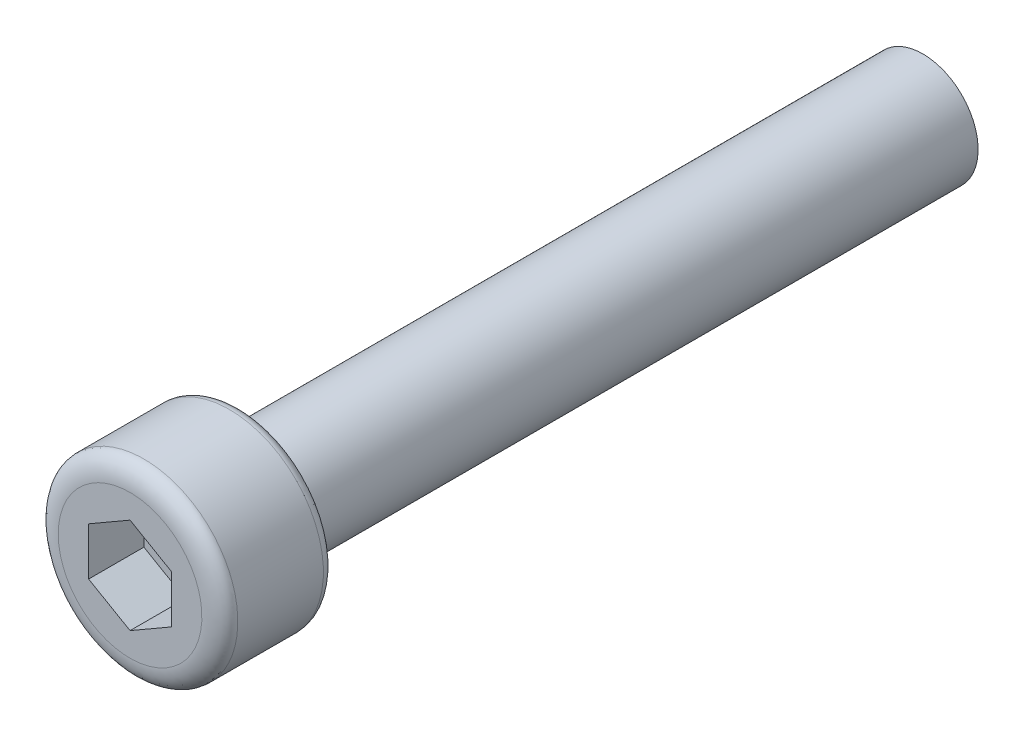
from build123d import *

# Parameters (mm, degrees)
CHAMFER_1_SIZE      = 0.3
CHAMFER_1_SIZE2     = 0.519615242
FILLET_1_R          = 0.4
FILLET_2_SIZE       = 0.5
FILLET_2_SIZE_2     = 0.8
CUT_EXTRUDE_1_DEPTH = 2


with BuildPart() as part:
    # 草图2 → 旋转1 (revolve)
    with BuildSketch(Plane(origin=(0, 0, 0), x_dir=(0, 0, -1), z_dir=(1, 0, 0)), mode=Mode.PRIVATE) as revolve_1_sk:
        Polygon((-14.5, 0), (-14.5, 3.4), (-10.5, 3.4), (-10.5, 2), (14.5, 2), (14.5, 0), align=None)
    revolve(revolve_1_sk.sketch.rotate(Axis((0, 0, -14.5), (0, 0, 1)), 90), axis=Axis((0, 0, -14.5), (0, 0, 1)))

    # 倒角1
    chamfer_1_edges = [part.edges().sort_by_distance(p)[0] for p in [
        (2, 0, -14.5),
    ]]
    chamfer_1_side = [part.faces().sort_by_distance(p)[0] for p in [
        (2, 0, -2),
    ]]
    chamfer(chamfer_1_edges, length=CHAMFER_1_SIZE, length2=CHAMFER_1_SIZE2, reference=chamfer_1_side[0])

    # 圆角1
    fillet_1_edges = [part.edges().sort_by_distance(p)[0] for p in [
        (3.4, 0, 10.5),
    ]]
    fillet(fillet_1_edges, radius=FILLET_1_R)

    # 圆角2
    # an asymmetric fillet: 0.8, 0.5 mm, written as the material it takes off along each edge
    with BuildSketch(Plane(origin=(0, 0, 14.5), x_dir=(-1, 0, 0), z_dir=(0, 1, 0))) as fillet_2_piece_1:
        with BuildLine():
            Bezier((3.4, -FILLET_2_SIZE), (3.4, 0), (3.4 - FILLET_2_SIZE_2, 0), weights=[1, 0.707106781, 1])
            Line((3.4 - FILLET_2_SIZE_2, 0), (3.4, 0))
            Line((3.4, 0), (3.4, -FILLET_2_SIZE))
        make_face()
    revolve(axis=Axis((0, 0, 14.5), (0, 0, 1)), mode=Mode.SUBTRACT)

    # 草图3 → 切除-拉伸1 (cut)
    with BuildSketch(Plane.XY.offset(14.5)):
        Polygon((0, 1.732050808), (-1.5, 0.866025404), (-1.5, -0.866025404), (0, -1.732050808), (1.5, -0.866025404), (1.5, 0.866025404), align=None)
    extrude(amount=-CUT_EXTRUDE_1_DEPTH, mode=Mode.SUBTRACT)


solid = part.part
